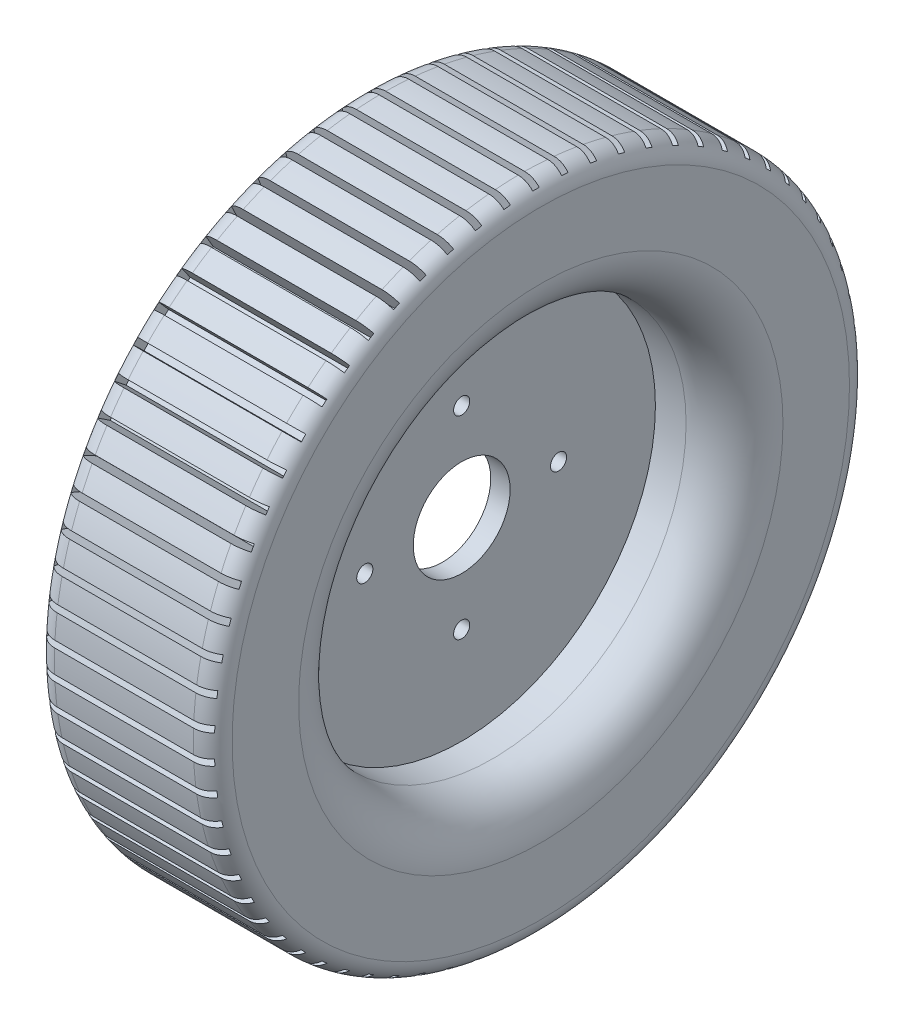
from build123d import *

# Parameters (mm, degrees)
SKETCH1_R           = 101.6
BOSS_EXTRUDE1_DEPTH = 27.5
CUT_EXTRUDE1_START  = -3
SKETCH2_R           = 60
CUT_EXTRUDE1_DEPTH  = 500
CUT_EXTRUDE2_START  = 503
SKETCH2_2_R         = 60
CUT_EXTRUDE2_DEPTH  = 500
FILLET1_R           = 15
FILLET5_R           = 6
SKETCH5_W           = 2
SKETCH5_H           = 10
CUT_EXTRUDE4_DEPTH  = 26
SKETCH6_R           = 15
CUT_EXTRUDE5_DEPTH  = 24
SKETCH7_R           = 2.5
CUT_EXTRUDE6_DEPTH  = 24


with BuildPart() as part:
    # Sketch1 → Boss-Extrude1 (new, symmetric)
    with BuildSketch(Plane(origin=(0, 0, 0), x_dir=(0, 0, -1), z_dir=(1, 0, 0))):
        Circle(SKETCH1_R)
    extrude(amount=BOSS_EXTRUDE1_DEPTH, both=True)

    # Sketch2 → Cut-Extrude1 (cut)
    with BuildSketch(Plane(origin=(0, 0, 0), x_dir=(0, 0, -1), z_dir=(1, 0, 0)).offset(CUT_EXTRUDE1_START)):
        Circle(SKETCH2_R)
    extrude(amount=-CUT_EXTRUDE1_DEPTH, mode=Mode.SUBTRACT)

    # Sketch2<2> → Cut-Extrude2 (cut)
    with BuildSketch(Plane(origin=(0, 0, 0), x_dir=(0, 0, -1), z_dir=(1, 0, 0)).offset(CUT_EXTRUDE2_START)):
        Circle(SKETCH2_2_R)
    extrude(amount=-CUT_EXTRUDE2_DEPTH, mode=Mode.SUBTRACT)

    # Fillet1
    fillet1_edges = [part.edges().sort_by_distance(p)[0] for p in [
        (-27.5, 0, 60),
        (27.5, 0, 60),
    ]]
    fillet(fillet1_edges, radius=FILLET1_R)

    # Fillet5
    fillet5_edges = [part.edges().sort_by_distance(p)[0] for p in [
        (27.5, 0, 101.6),
        (-27.5, 0, 101.6),
    ]]
    fillet(fillet5_edges, radius=FILLET5_R)

    # Sketch5 → Cut-Extrude4 (cut, symmetric)
    with BuildSketch(Plane(origin=(0, 0, 0), x_dir=(0, 0, -1), z_dir=(1, 0, 0))):
        Polygon((8.416153141, 104.666940178), (10.408101729, 104.487661561), (9.51170864, 94.527918621), (7.519760052, 94.707197238), align=None)
        with Locations((0, 100)):
            Rectangle(SKETCH5_W, SKETCH5_H)
        Polygon((17.764544365, 103.491163698), (19.732403542, 103.134049908), (17.946834594, 93.294754022), (15.978975417, 93.651867812), align=None)
        Polygon((26.969905924, 101.482137219), (28.897831645, 100.950063528), (26.23746319, 91.310434921), (24.309537468, 91.842508612), align=None)
        Polygon((35.958121658, 98.656036241), (37.830591399, 97.953286593), (34.316843158, 88.590937887), (32.444373417, 89.293687535), align=None)
        Polygon((44.656823739, 95.035614869), (46.458761475, 94.167847391), (42.119924084, 85.158158712), (40.317986348, 86.02592619), align=None)
        Polygon((52.995975334, 90.650022606), (54.712872921, 89.624224051), (49.583880147, 81.039736115), (47.86698256, 82.06553467), align=None)
        Polygon((60.908434496, 85.534569662), (62.526468485, 84.358999157), (56.648615962, 76.268829213), (55.030581973, 77.444399718), align=None)
        Polygon((68.330494758, 79.730442656), (69.83663769, 78.414565204), (63.25725043, 70.883850544), (61.751107498, 72.199727996), align=None)
        Polygon((75.202398053, 73.284373007), (76.584523351, 71.83878328), (69.356574713, 64.92815679), (67.974449415, 66.373746518), align=None)
        Polygon((81.468815857, 66.248260678), (82.715795461, 64.684597713), (74.897480636, 58.449699694), (73.650501033, 60.013362659), align=None)
        Polygon((87.079294659, 58.678756306), (88.181088622, 57.009609799), (79.835356085, 51.500639984), (78.733562122, 53.169786492), align=None)
        Polygon((91.988662182, 50.636805092), (92.936399507, 48.875614028), (84.130444189, 44.136927403), (83.182706864, 45.898118467), align=None)
        Polygon((96.157391086, 42.187156096), (96.94344115, 40.348100551), (87.748163424, 36.417850235), (86.962113361, 38.25690578), align=None)
        Polygon((99.551917217, 33.397840926), (100.169951205, 31.495727893), (90.659386042, 28.405557949), (90.041352054, 30.307670982), align=None)
        Polygon((102.144909845, 24.339625978), (102.589951713, 22.389770153), (92.840672591, 20.164560814), (92.395630723, 22.114416638), align=None)
        Polygon((103.91549172, 15.085442673), (104.183958251, 13.103543149), (94.274460634, 11.761210491), (94.005994102, 13.743110014), align=None)
        Polygon((104.849407157, 5.709800253), (104.939136817, 3.71181412), (94.949206152, 3.263165817), (94.859476491, 5.26115195), align=None)
        Polygon((104.939136817, -3.71181412), (104.849407157, -5.709800253), (94.859476491, -5.26115195), (94.949206152, -3.263165817), align=None)
        Polygon((104.183958251, -13.103543149), (103.91549172, -15.085442673), (94.005994102, -13.743110014), (94.274460634, -11.761210491), align=None)
        Polygon((102.589951713, -22.389770153), (102.144909845, -24.339625978), (92.395630723, -22.114416638), (92.840672591, -20.164560814), align=None)
        Polygon((100.169951205, -31.495727893), (99.551917217, -33.397840926), (90.041352054, -30.307670982), (90.659386042, -28.405557949), align=None)
        Polygon((96.94344115, -40.348100551), (96.157391086, -42.187156096), (86.962113361, -38.25690578), (87.748163424, -36.417850235), align=None)
        Polygon((92.936399507, -48.875614028), (91.988662183, -50.636805092), (83.182706864, -45.898118467), (84.130444189, -44.136927403), align=None)
        Polygon((88.181088622, -57.009609799), (87.079294659, -58.678756306), (78.733562122, -53.169786492), (79.835356085, -51.500639984), align=None)
        Polygon((82.715795461, -64.684597713), (81.468815857, -66.248260678), (73.650501033, -60.013362659), (74.897480636, -58.449699694), align=None)
        Polygon((76.584523351, -71.83878328), (75.202398053, -73.284373007), (67.974449415, -66.373746518), (69.356574713, -64.92815679), align=None)
        Polygon((69.83663769, -78.414565204), (68.330494758, -79.730442656), (61.751107498, -72.199727996), (63.25725043, -70.883850544), align=None)
        Polygon((62.526468485, -84.358999157), (60.908434496, -85.534569662), (55.030581973, -77.444399718), (56.648615962, -76.268829213), align=None)
        Polygon((54.712872921, -89.624224051), (52.995975334, -90.650022606), (47.86698256, -82.06553467), (49.583880147, -81.039736115), align=None)
        Polygon((46.458761475, -94.167847391), (44.656823739, -95.035614869), (40.317986348, -86.02592619), (42.119924084, -85.158158712), align=None)
        Polygon((37.830591399, -97.953286593), (35.958121658, -98.656036241), (32.444373417, -89.293687535), (34.316843158, -88.590937887), align=None)
        Polygon((28.897831645, -100.950063527), (26.969905924, -101.482137219), (24.309537468, -91.842508612), (26.23746319, -91.310434921), align=None)
        Polygon((19.732403542, -103.134049908), (17.764544365, -103.491163698), (15.978975417, -93.651867812), (17.946834594, -93.294754022), align=None)
        Polygon((10.408101729, -104.487661561), (8.416153141, -104.666940178), (7.519760052, -94.707197238), (9.51170864, -94.527918621), align=None)
        with Locations((0, -100)):
            Rectangle(SKETCH5_W, SKETCH5_H)
        Polygon((-8.416153141, -104.666940178), (-10.408101729, -104.487661561), (-9.51170864, -94.527918621), (-7.519760052, -94.707197238), align=None)
        Polygon((-17.764544365, -103.491163698), (-19.732403542, -103.134049908), (-17.946834594, -93.294754022), (-15.978975417, -93.651867812), align=None)
        Polygon((-26.969905924, -101.482137219), (-28.897831645, -100.950063528), (-26.23746319, -91.310434921), (-24.309537468, -91.842508612), align=None)
        Polygon((-35.958121658, -98.656036241), (-37.830591399, -97.953286593), (-34.316843158, -88.590937887), (-32.444373417, -89.293687535), align=None)
        Polygon((-44.656823739, -95.035614869), (-46.458761475, -94.167847391), (-42.119924084, -85.158158712), (-40.317986348, -86.02592619), align=None)
        Polygon((-52.995975334, -90.650022606), (-54.712872921, -89.624224051), (-49.583880147, -81.039736115), (-47.86698256, -82.06553467), align=None)
        Polygon((-60.908434496, -85.534569662), (-62.526468485, -84.358999157), (-56.648615962, -76.268829213), (-55.030581973, -77.444399718), align=None)
        Polygon((-68.330494758, -79.730442656), (-69.83663769, -78.414565204), (-63.25725043, -70.883850544), (-61.751107498, -72.199727996), align=None)
        Polygon((-75.202398053, -73.284373007), (-76.584523351, -71.83878328), (-69.356574713, -64.92815679), (-67.974449415, -66.373746518), align=None)
        Polygon((-81.468815857, -66.248260678), (-82.715795461, -64.684597713), (-74.897480636, -58.449699694), (-73.650501033, -60.013362659), align=None)
        Polygon((-87.079294659, -58.678756306), (-88.181088622, -57.009609799), (-79.835356085, -51.500639984), (-78.733562122, -53.169786492), align=None)
        Polygon((-91.988662182, -50.636805092), (-92.936399507, -48.875614028), (-84.130444189, -44.136927403), (-83.182706864, -45.898118467), align=None)
        Polygon((-96.157391086, -42.187156096), (-96.94344115, -40.348100551), (-87.748163424, -36.417850235), (-86.962113361, -38.25690578), align=None)
        Polygon((-99.551917217, -33.397840926), (-100.169951205, -31.495727893), (-90.659386042, -28.405557949), (-90.041352054, -30.307670982), align=None)
        Polygon((-102.144909845, -24.339625978), (-102.589951713, -22.389770153), (-92.840672591, -20.164560814), (-92.395630723, -22.114416638), align=None)
        Polygon((-103.91549172, -15.085442673), (-104.183958251, -13.103543149), (-94.274460634, -11.761210491), (-94.005994102, -13.743110014), align=None)
        Polygon((-104.849407156, -5.709800253), (-104.939136817, -3.71181412), (-94.949206152, -3.263165817), (-94.859476491, -5.26115195), align=None)
        Polygon((-104.939136817, 3.71181412), (-104.849407156, 5.709800253), (-94.859476491, 5.26115195), (-94.949206152, 3.263165817), align=None)
        Polygon((-104.183958251, 13.103543149), (-103.91549172, 15.085442673), (-94.005994102, 13.743110014), (-94.274460634, 11.761210491), align=None)
        Polygon((-102.589951713, 22.389770153), (-102.144909845, 24.339625978), (-92.395630723, 22.114416638), (-92.840672591, 20.164560814), align=None)
        Polygon((-100.169951205, 31.495727893), (-99.551917217, 33.397840926), (-90.041352054, 30.307670982), (-90.659386042, 28.405557949), align=None)
        Polygon((-96.94344115, 40.348100551), (-96.157391086, 42.187156096), (-86.962113361, 38.25690578), (-87.748163424, 36.417850235), align=None)
        Polygon((-92.936399507, 48.875614028), (-91.988662182, 50.636805092), (-83.182706864, 45.898118467), (-84.130444189, 44.136927403), align=None)
        Polygon((-88.181088622, 57.009609799), (-87.079294659, 58.678756306), (-78.733562122, 53.169786492), (-79.835356085, 51.500639984), align=None)
        Polygon((-82.715795461, 64.684597713), (-81.468815857, 66.248260678), (-73.650501033, 60.013362659), (-74.897480636, 58.449699694), align=None)
        Polygon((-76.584523351, 71.83878328), (-75.202398053, 73.284373007), (-67.974449415, 66.373746518), (-69.356574713, 64.92815679), align=None)
        Polygon((-69.83663769, 78.414565204), (-68.330494758, 79.730442656), (-61.751107498, 72.199727996), (-63.25725043, 70.883850544), align=None)
        Polygon((-62.526468485, 84.358999157), (-60.908434496, 85.534569662), (-55.030581973, 77.444399718), (-56.648615962, 76.268829213), align=None)
        Polygon((-54.712872921, 89.624224051), (-52.995975334, 90.650022606), (-47.86698256, 82.06553467), (-49.583880147, 81.039736115), align=None)
        Polygon((-46.458761475, 94.167847391), (-44.656823739, 95.035614869), (-40.317986348, 86.02592619), (-42.119924084, 85.158158712), align=None)
        Polygon((-37.830591399, 97.953286593), (-35.958121658, 98.656036241), (-32.444373417, 89.293687535), (-34.316843158, 88.590937887), align=None)
        Polygon((-28.897831645, 100.950063527), (-26.969905924, 101.482137219), (-24.309537468, 91.842508612), (-26.23746319, 91.310434921), align=None)
        Polygon((-19.732403542, 103.134049908), (-17.764544365, 103.491163698), (-15.978975417, 93.651867812), (-17.946834594, 93.294754022), align=None)
        Polygon((-10.408101729, 104.487661561), (-8.416153141, 104.666940178), (-7.519760052, 94.707197238), (-9.51170864, 94.527918621), align=None)
    extrude(amount=CUT_EXTRUDE4_DEPTH, both=True, mode=Mode.SUBTRACT)

    # Sketch6 → Cut-Extrude5 (cut, symmetric)
    with BuildSketch(Plane(origin=(3, 0, 0), x_dir=(0, 0, -1), z_dir=(1, 0, 0))):
        Circle(SKETCH6_R)
    extrude(amount=CUT_EXTRUDE5_DEPTH, both=True, mode=Mode.SUBTRACT)

    # Sketch7 → Cut-Extrude6 (cut, symmetric)
    with BuildSketch(Plane.ZY.offset(3)):
        with Locations((30, 0)):
            Circle(SKETCH7_R)
        with Locations((0, -30)):
            Circle(SKETCH7_R)
        with Locations((-30, 0)):
            Circle(SKETCH7_R)
        with Locations((0, 30)):
            Circle(SKETCH7_R)
    extrude(amount=CUT_EXTRUDE6_DEPTH, both=True, mode=Mode.SUBTRACT)


solid = part.part
